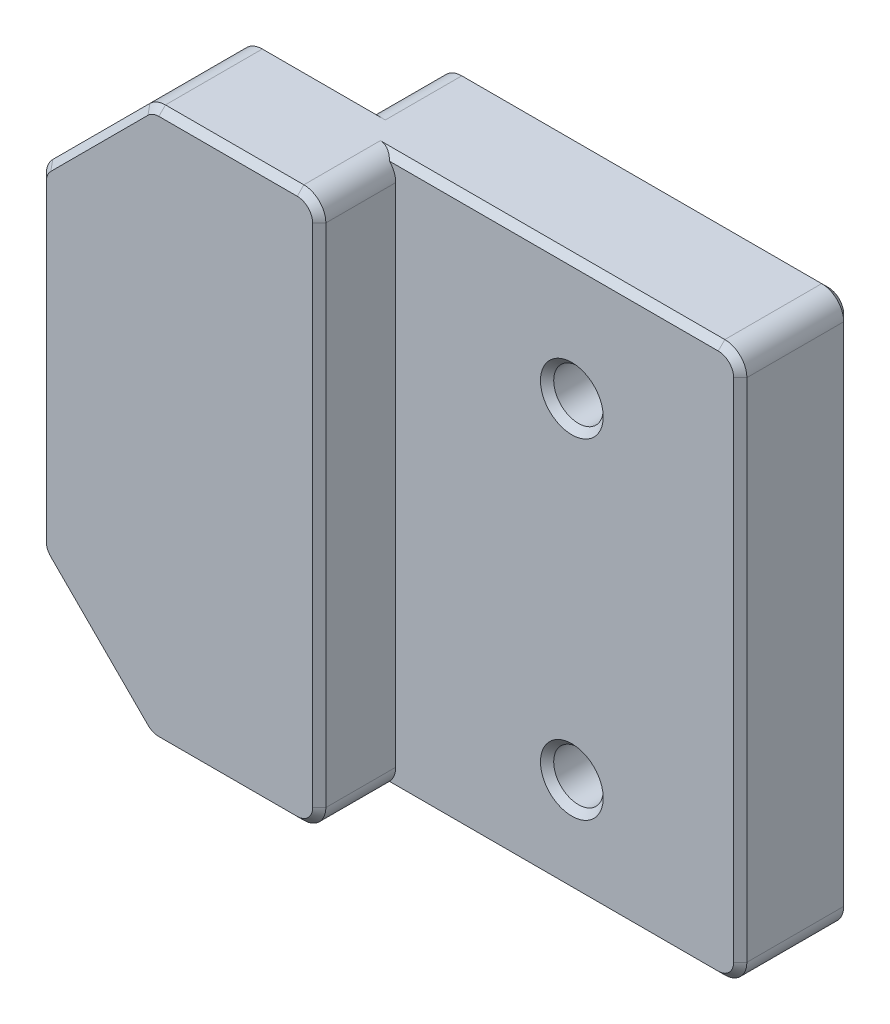
from build123d import *

# Parameters (mm, degrees)
BOSS_EXTRUDE1_DEPTH = 25
SKETCH2_R           = 1.125
CUT_EXTRUDE1_DEPTH  = 25
CHAMFER1_SIZE       = 5
FILLET1_R           = 1
CHAMFER2_SIZE       = 0.3


with BuildPart() as part:
    # Sketch1 → Boss-Extrude1 (new body)
    with BuildSketch(Plane(origin=(0, 0, 0), x_dir=(1, 0, 0), z_dir=(0, 1, 0))):
        Polygon((0, 0), (-18.35, 0), (-18.35, -3.475), (-28.35, -3.475), (-28.35, -8.475), (-15.65, -8.475), (-15.65, -5), (0, -5), align=None)
    extrude(amount=BOSS_EXTRUDE1_DEPTH)

    # Sketch2 → Cut-Extrude1 (cut)
    with BuildSketch(Plane.XY.offset(5)):
        with Locations((-7.65, 4.5)):
            Circle(SKETCH2_R)
        with Locations((-7.65, 19.5)):
            Circle(SKETCH2_R)
    extrude(amount=-CUT_EXTRUDE1_DEPTH, mode=Mode.SUBTRACT)

    # Chamfer1
    chamfer1_edges = [part.edges().sort_by_distance(p)[0] for p in [
        (-28.35, 0, 5.975),
        (-28.35, 25, 5.975),
    ]]
    chamfer(chamfer1_edges, length=CHAMFER1_SIZE)

    # Fillet1
    fillet1_edges = [part.edges().sort_by_distance(p)[0] for p in [
        (0, 0, 2.5),
        (-28.35, 20, 5.975),
        (-15.65, 25, 6.7375),
        (-15.65, 0, 6.7375),
        (-23.35, 0, 5.975),
        (-28.35, 5, 5.975),
        (-23.35, 25, 5.975),
        (0, 25, 2.5),
        (-18.35, 25, 1.7375),
        (-18.35, 0, 1.7375),
    ]]
    fillet(fillet1_edges, radius=FILLET1_R)

    # Chamfer2
    chamfer2_edges = [part.edges().sort_by_distance(p)[0] for p in [
        (-8.775, 4.5, 0),
        (-8.775, 19.5, 0),
        (-8.775, 4.5, 5),
        (-8.775, 19.5, 5),
        (-9.175, 0, 0),
        (-0.292893219, 0.292893219, 0),
        (0, 12.5, 0),
        (-0.292893219, 24.707106781, 0),
        (-9.175, 25, 0),
        (-28.35, 12.5, 8.475),
        (-28.273879533, 19.96846987, 8.475),
        (-28.273879533, 5.03153013, 8.475),
        (-25.85, 22.5, 8.475),
        (-25.85, 2.5, 8.475),
        (-23.31846987, 24.923879533, 8.475),
        (-23.31846987, 0.076120467, 8.475),
        (-19.792893219, 25, 8.475),
        (-19.792893219, 0, 8.475),
        (-15.942893219, 24.707106781, 8.475),
        (-15.942893219, 0.292893219, 8.475),
        (-15.65, 12.5, 8.475),
        (-18.057106781, 0.292893219, 0),
        (-18.35, 12.5, 0),
        (-18.057106781, 24.707106781, 0),
        (-8.825, 25, 5),
        (-8.825, 0, 5),
        (-0.292893219, 24.707106781, 5),
        (-0.292893219, 0.292893219, 5),
        (0, 12.5, 5),
        (-20.142893219, 0, 3.475),
        (-23.31846987, 0.076120467, 3.475),
        (-25.85, 2.5, 3.475),
        (-28.273879533, 5.03153013, 3.475),
        (-28.35, 12.5, 3.475),
        (-20.142893219, 25, 3.475),
        (-28.273879533, 19.96846987, 3.475),
        (-23.31846987, 24.923879533, 3.475),
        (-25.85, 22.5, 3.475),
    ]]
    chamfer(chamfer2_edges, length=CHAMFER2_SIZE)


solid = part.part
